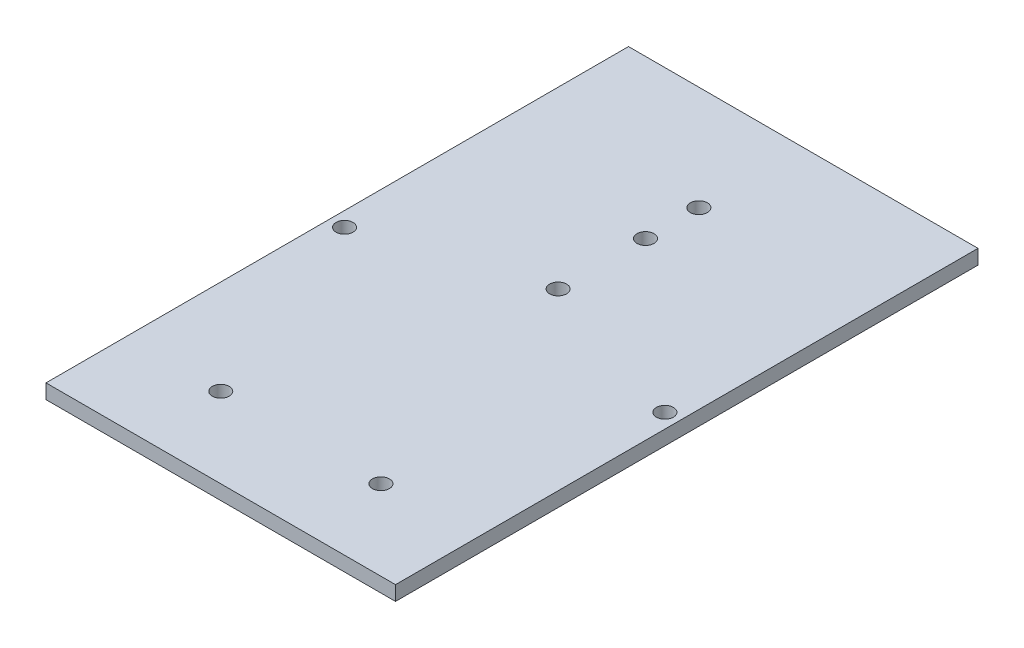
from build123d import *

# Parameters (mm, degrees)
SKETCH1_W           = 72
SKETCH1_H           = 120
SKETCH1_R           = 1.75
BOSS_EXTRUDE1_DEPTH = 3


with BuildPart() as part:
    # Sketch1 → Boss-Extrude1 (new body)
    with BuildSketch(Plane(origin=(0, 0, 0), x_dir=(1, 0, 0), z_dir=(0, 1, 0))):
        Rectangle(SKETCH1_W, SKETCH1_H)
        with Locations((-16.5, -43.5)):
            Circle(SKETCH1_R, mode=Mode.SUBTRACT)
        with Locations((-33, -1.5)):
            Circle(SKETCH1_R, mode=Mode.SUBTRACT)
        with Locations((16.5, -43.5)):
            Circle(SKETCH1_R, mode=Mode.SUBTRACT)
        with Locations((33, -1.5)):
            Circle(SKETCH1_R, mode=Mode.SUBTRACT)
        with Locations((0, 38.5)):
            Circle(SKETCH1_R, mode=Mode.SUBTRACT)
        with BuildLine():
            ThreePointArc((0, 7.75), (-1.237436867, 10.737436867), (1.75, 9.5))
            ThreePointArc((1.75, 9.5), (1.237436867, 8.262563133), (0, 7.75))
        make_face(mode=Mode.SUBTRACT)
        with Locations((0, 27.5)):
            Circle(SKETCH1_R, mode=Mode.SUBTRACT)
    extrude(amount=BOSS_EXTRUDE1_DEPTH)


solid = part.part
